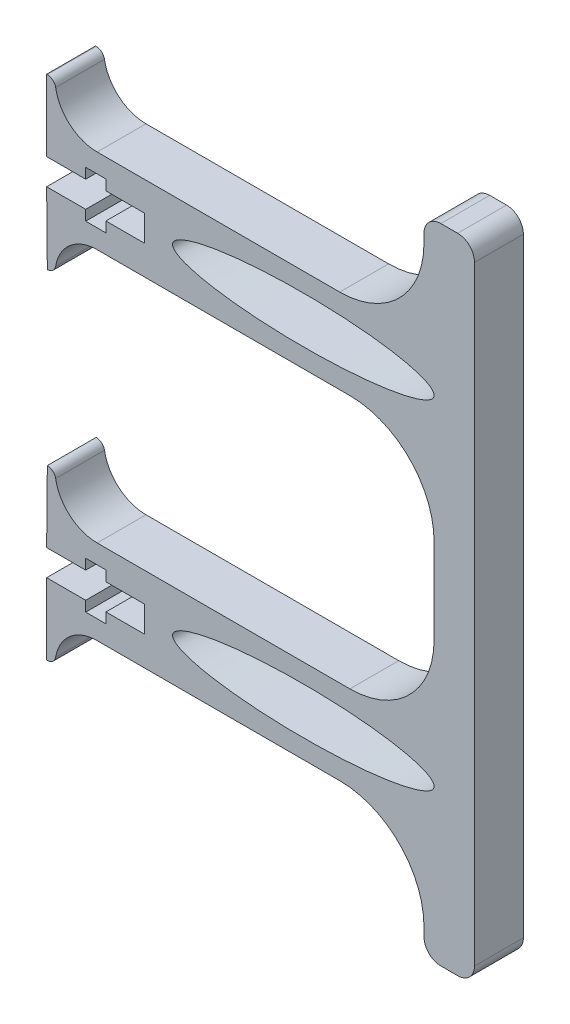
from build123d import *

# Parameters (mm, degrees)
SKETCH1_RX          = 15.52446594
SKETCH1_RY          = 2.772242018
BOSS_EXTRUDE1_DEPTH = 5.8


with BuildPart() as part:
    # Sketch1 → Boss-Extrude1 (new body)
    with BuildSketch(Plane.XY):
        with BuildLine():
            Line((-10.059850626, 29.356682147), (-12.459850626, 29.356682147))
            Line((-12.459850626, 29.356682147), (-12.459850626, 28.132280135))
            Line((-12.459850626, 28.132280135), (-17.098055654, 28.132280135))
            Line((-17.098055654, 28.132280135), (-17.098055654, 36.606682147))
            Line((-17.098055654, 36.606682147), (-17.014135437, 36.606682147))
            ThreePointArc((-17.014135437, 36.606682147), (-16.368638213, 36.370444763), (-16.02812214, 35.773348814))
            ThreePointArc((-16.02812214, 35.773348814), (-14.325541776, 32.787869068), (-11.098055654, 31.606682147))
            Line((-11.098055654, 31.606682147), (17.701944346, 31.606682147))
            ThreePointArc((17.701944346, 31.606682147), (24.773012158, 34.535614335), (27.701944346, 41.606682147))
            Line((27.701944346, 41.606682147), (27.701944346, 42.654556268))
            ThreePointArc((27.701944346, 42.654556268), (28.287730784, 44.068769831), (29.701944346, 44.654556268))
            Line((29.701944346, 44.654556268), (31.701944346, 44.654556268))
            ThreePointArc((31.701944346, 44.654556268), (33.116157908, 44.068769831), (33.701944346, 42.654556268))
            Line((33.701944346, 42.654556268), (33.701944346, 26.606682147))
            Line((33.701944346, 26.606682147), (33.701944346, 26.562198111))
            Line((33.701944346, 26.562198111), (33.701944346, -13.588997864))
            Line((33.701944346, -13.588997864), (33.701944346, -13.6334819))
            Line((33.701944346, -13.6334819), (33.701944346, -29.681356021))
            ThreePointArc((33.701944346, -29.681356021), (33.116157908, -31.095569584), (31.701944346, -31.681356021))
            Line((31.701944346, -31.681356021), (29.701944346, -31.681356021))
            ThreePointArc((29.701944346, -31.681356021), (28.287730784, -31.095569584), (27.701944346, -29.681356021))
            Line((27.701944346, -29.681356021), (27.701944346, -28.6334819))
            ThreePointArc((27.701944346, -28.6334819), (24.773012158, -21.562414088), (17.701944346, -18.6334819))
            Line((17.701944346, -18.6334819), (-11.098055654, -18.6334819))
            ThreePointArc((-11.098055654, -18.6334819), (-14.325541776, -19.814668821), (-16.02812214, -22.800148567))
            ThreePointArc((-16.02812214, -22.800148567), (-16.368638213, -23.397244516), (-17.014135437, -23.6334819))
            Line((-17.014135437, -23.6334819), (-17.098055654, -23.6334819))
            Line((-17.098055654, -23.6334819), (-17.098055654, -15.159079888))
            Line((-17.098055654, -15.159079888), (-12.459850626, -15.159079888))
            Line((-12.459850626, -15.159079888), (-12.459850626, -16.3834819))
            Line((-12.459850626, -16.3834819), (-10.059850626, -16.3834819))
            Line((-10.059850626, -16.3834819), (-10.059850626, -15.159079888))
            Line((-10.059850626, -15.159079888), (-5.45496555, -15.159079888))
            Line((-5.45496555, -15.159079888), (-5.45496555, -12.063399877))
            Line((-5.45496555, -12.063399877), (-10.059850626, -12.063399877))
            Line((-10.059850626, -12.063399877), (-10.059850626, -10.838997864))
            Line((-10.059850626, -10.838997864), (-12.459850626, -10.838997864))
            Line((-12.459850626, -10.838997864), (-12.459850626, -12.063399877))
            Line((-12.459850626, -12.063399877), (-17.098055654, -12.063399877))
            Line((-17.098055654, -12.063399877), (-17.014135437, -3.588997864))
            ThreePointArc((-17.014135437, -3.588997864), (-16.368638213, -3.825235249), (-16.02812214, -4.422331198))
            ThreePointArc((-16.02812214, -4.422331198), (-14.325541776, -7.407810944), (-11.098055654, -8.588997864))
            Line((-11.098055654, -8.588997864), (18.901944346, -8.588997864))
            ThreePointArc((18.901944346, -8.588997864), (25.973012158, -5.660065676), (28.901944346, 1.411002136))
            Line((28.901944346, 1.411002136), (28.901944346, 11.562198111))
            ThreePointArc((28.901944346, 11.562198111), (25.973012158, 18.633265923), (18.901944346, 21.562198111))
            Line((18.901944346, 21.562198111), (-11.098055654, 21.562198111))
            ThreePointArc((-11.098055654, 21.562198111), (-14.325541776, 20.38101119), (-16.02812214, 17.395531445))
            ThreePointArc((-16.02812214, 17.395531445), (-16.368638213, 16.798435495), (-17.014135437, 16.562198111))
            Line((-17.014135437, 16.562198111), (-17.098055654, 25.036600123))
            Line((-17.098055654, 25.036600123), (-12.459850626, 25.036600123))
            Line((-12.459850626, 25.036600123), (-12.459850626, 23.812198111))
            Line((-12.459850626, 23.812198111), (-10.059850626, 23.812198111))
            Line((-10.059850626, 23.812198111), (-10.059850626, 25.036600123))
            Line((-10.059850626, 25.036600123), (-5.45496555, 25.036600123))
            Line((-5.45496555, 25.036600123), (-5.45496555, 28.132280135))
            Line((-5.45496555, 28.132280135), (-10.059850626, 28.132280135))
            Line((-10.059850626, 28.132280135), (-10.059850626, 29.356682147))
        make_face()
        with Locations((13.377478406, 26.584440129)):
            Ellipse(SKETCH1_RX, SKETCH1_RY, mode=Mode.SUBTRACT)
        with Locations((13.377478406, -13.611239882)):
            Ellipse(SKETCH1_RX, SKETCH1_RY, mode=Mode.SUBTRACT)
    extrude(amount=BOSS_EXTRUDE1_DEPTH)


solid = part.part
